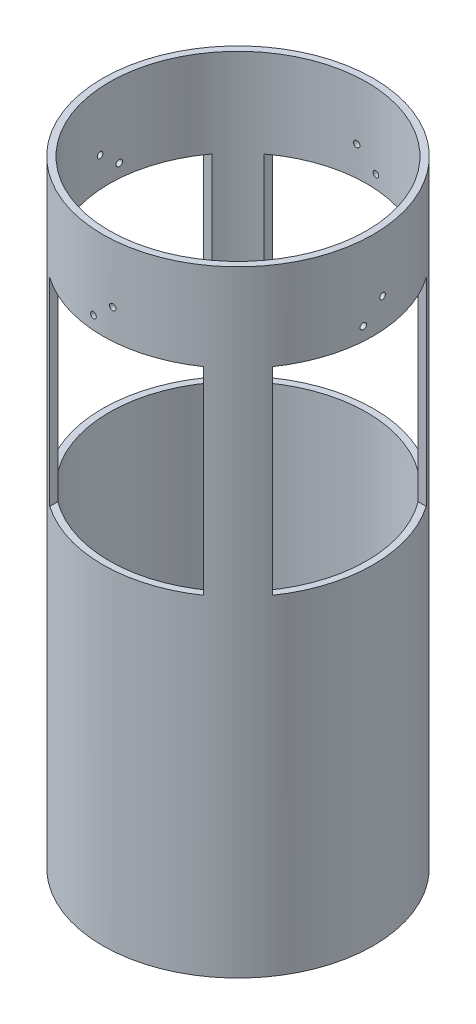
from build123d import *

# Parameters (mm, degrees)
SKETCH1_R           = 78.105
SKETCH1_R_2         = 74.295
BOSS_EXTRUDE1_DEPTH = 177.8
SKETCH6_W           = 88.9
SKETCH6_H           = 114.3
CUT_EXTRUDE6_DEPTH  = 20.574
CIRPATTERN9_COUNT   = 4
SKETCH7_R           = 1.7526
CUT_EXTRUDE7_DEPTH  = 17.78
CIRPATTERN10_COUNT  = 4
BOSS_EXTRUDE2_START = 25.4
SKETCH8_R           = 78.105
SKETCH8_R_2         = 74.295
BOSS_EXTRUDE2_DEPTH = 25.4
BOSS_EXTRUDE3_START = 152.4
SKETCH9_R           = 78.105
SKETCH9_R_2         = 74.295
BOSS_EXTRUDE3_DEPTH = 152.4


with BuildPart() as part:
    # Sketch1 → Boss-Extrude1 (new body)
    with BuildSketch(Plane(origin=(0, 0, 0), x_dir=(1, 0, 0), z_dir=(0, 1, 0))):
        Circle(SKETCH1_R)
        Circle(SKETCH1_R_2, mode=Mode.SUBTRACT)
    extrude(amount=BOSS_EXTRUDE1_DEPTH)

    # Sketch6 → Cut-Extrude6 (cut)
    with BuildSketch(Plane(origin=(0, 0, -78.105), x_dir=(-1, 0, 0), z_dir=(0, 0, -1))):
        with Locations((0, 69.85)):
            Rectangle(SKETCH6_W, SKETCH6_H)
    cut_extrude6 = extrude(amount=-CUT_EXTRUDE6_DEPTH, mode=Mode.SUBTRACT)

    # CirPattern9: Cut-Extrude6 ×4 about axis
    cirpattern9_axis = Axis((0, 0, 0), (0, 1, 0))
    for i in range(1, CIRPATTERN9_COUNT):
        add(cut_extrude6.rotate(cirpattern9_axis, i * 360 / CIRPATTERN9_COUNT), mode=Mode.SUBTRACT)

    # Sketch7 → Cut-Extrude7 (cut)
    with BuildSketch(Plane(origin=(0, 0, -78.105), x_dir=(-1, 0, 0), z_dir=(0, 0, -1))):
        with Locations((0, 185.42)):
            Circle(SKETCH7_R)
        with Locations((5.55625, 144.145)):
            Circle(SKETCH7_R)
        with Locations((-5.55625, 134.62)):
            Circle(SKETCH7_R)
    cut_extrude7 = extrude(amount=-CUT_EXTRUDE7_DEPTH, mode=Mode.SUBTRACT)

    # CirPattern10: Cut-Extrude7 ×4 about axis
    cirpattern10_axis = Axis((0, 177.8, 0), (0, 1, 0))
    for i in range(1, CIRPATTERN10_COUNT):
        add(cut_extrude7.rotate(cirpattern10_axis, i * 360 / CIRPATTERN10_COUNT), mode=Mode.SUBTRACT)

    # Sketch8 → Boss-Extrude2 (add)
    with BuildSketch(Plane.XZ.offset(BOSS_EXTRUDE2_START)):
        Circle(SKETCH8_R)
        Circle(SKETCH8_R_2, mode=Mode.SUBTRACT)
    extrude(amount=-BOSS_EXTRUDE2_DEPTH)

    # Sketch9 → Boss-Extrude3 (add)
    with BuildSketch(Plane.XZ.offset(25.4).offset(BOSS_EXTRUDE3_START)):
        Circle(SKETCH9_R)
        Circle(SKETCH9_R_2, mode=Mode.SUBTRACT)
    extrude(amount=-BOSS_EXTRUDE3_DEPTH)


solid = part.part
